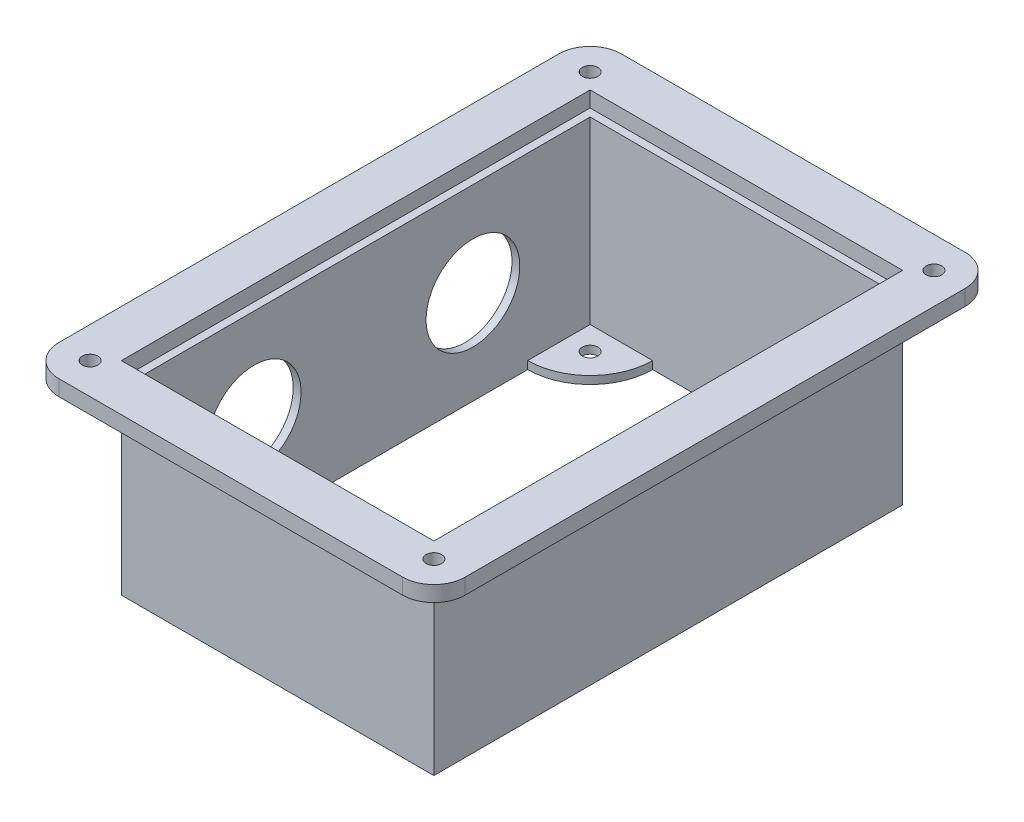
from build123d import *

# Parameters (mm, degrees)
SIDE_VIEW_LARGE_RECT_W       = 120
SIDE_VIEW_LARGE_RECT_H       = 48
SALIENTE_EXTRUIR1_DEPTH      = 80
SALIENTE_EXTRUIR2_DEPTH      = 52
SALIENTE_EXTRUIR2_DEPTH_BACK = 52
CROQUIS4_W                   = 144
CROQUIS4_H                   = 4
CROQUIS6_W                   = 80
CROQUIS6_H                   = 120
CORTAR_EXTRUIR2_DEPTH        = 4
CROQUIS7_W                   = 76
CROQUIS7_H                   = 116
CORTAR_EXTRUIR3_DEPTH        = 168.904734895
CROQUIS8_W                   = 16
CROQUIS8_H                   = 16
SALIENTE_EXTRUIR3_DEPTH      = 2
MATRIZL1_COUNT               = 2
MATRIZL1_PITCH               = 60
MATRIZL1_COUNT_DIR2          = 2
MATRIZL1_PITCH_DIR2          = 100
REDONDEO1_R                  = 16
REDONDEO2_R                  = 16
REDONDEO3_R                  = 16
REDONDEO4_R                  = 16
REDONDEO5_R                  = 8
CROQUIS10_R                  = 2
CORTAR_EXTRUIR4_DEPTH        = 170.091691103
MATRIZL2_COUNT               = 2
MATRIZL2_PITCH               = 88
MATRIZL2_COUNT_DIR2          = 2
MATRIZL2_PITCH_DIR2          = 128
CROQUIS11_R                  = 2
CORTAR_EXTRUIR5_DEPTH        = 170.091691103
MATRIZL4_COUNT               = 2
MATRIZL4_PITCH               = 64
MATRIZL4_COUNT_DIR2          = 2
MATRIZL4_PITCH_DIR2          = 104
CROQUIS12_R                  = 12
CORTAR_EXTRUIR6_DEPTH        = 2


with BuildPart() as part:
    # Side-view-large-rect → Saliente-Extruir1 (new body)
    with BuildSketch(Plane(origin=(0, 0, 0), x_dir=(0, 0, -1), z_dir=(1, 0, 0))):
        with Locations((-60, 24)):
            Rectangle(SIDE_VIEW_LARGE_RECT_W, SIDE_VIEW_LARGE_RECT_H)
    extrude(amount=SALIENTE_EXTRUIR1_DEPTH)

    # Croquis4 → Saliente-Extruir2 (add, two sides: drawn at the far end of the back side and taken through both)
    with BuildSketch(Plane.ZY.offset(-40).offset(-SALIENTE_EXTRUIR2_DEPTH_BACK)):
        with Locations((60, 50)):
            Rectangle(CROQUIS4_W, CROQUIS4_H)
    extrude(amount=SALIENTE_EXTRUIR2_DEPTH + SALIENTE_EXTRUIR2_DEPTH_BACK)

    # Croquis6 → Cortar-Extruir2 (cut)
    with BuildSketch(Plane(origin=(0, 52, 0), x_dir=(1, 0, 0), z_dir=(0, 1, 0))):
        with Locations((40, -60)):
            Rectangle(CROQUIS6_W, CROQUIS6_H)
    extrude(amount=-CORTAR_EXTRUIR2_DEPTH, mode=Mode.SUBTRACT)


with BuildPart() as cortar_extruir2_piece_1:
    # of the separate pieces the step leaves, piece 1, a body of its own (cortar_extruir2_pieces)
    add(part.part.solids().sort_by_distance((0, 0, 120))[0])

    # Croquis7 → Cortar-Extruir3 (cut, through all)
    with BuildSketch(Plane(origin=(0, 48, 0), x_dir=(1, 0, 0), z_dir=(0, 1, 0))):
        with Locations((40, -60)):
            Rectangle(CROQUIS7_W, CROQUIS7_H)
    extrude(amount=-CORTAR_EXTRUIR3_DEPTH, mode=Mode.SUBTRACT)

    # Croquis8 → Saliente-Extruir3 (add)
    with BuildSketch(Plane(origin=(0, 0, 0), x_dir=(-1, 0, 0), z_dir=(0, -1, 0))):
        with Locations((-70, -10)):
            Rectangle(CROQUIS8_W, CROQUIS8_H)
    saliente_extruir3 = extrude(amount=-SALIENTE_EXTRUIR3_DEPTH)

    # MatrizL1: Saliente-Extruir3 2 × 2
    with Locations(*[(-i * MATRIZL1_PITCH, 0, j * MATRIZL1_PITCH_DIR2) for i in range(MATRIZL1_COUNT) for j in range(MATRIZL1_COUNT_DIR2) if (i, j) != (0, 0)]):
        add(saliente_extruir3)

    # Redondeo1
    redondeo1_edges = [cortar_extruir2_piece_1.edges().sort_by_distance(p)[0] for p in [
        (62, 1, 18),
    ]]
    fillet(redondeo1_edges, radius=REDONDEO1_R - 0.0001)  # a hair under: the kernel refuses the full size

    # Redondeo2
    redondeo2_edges = [cortar_extruir2_piece_1.edges().sort_by_distance(p)[0] for p in [
        (18, 1, 18),
    ]]
    fillet(redondeo2_edges, radius=REDONDEO2_R - 0.0001)  # a hair under: the kernel refuses the full size

    # Redondeo3
    redondeo3_edges = [cortar_extruir2_piece_1.edges().sort_by_distance(p)[0] for p in [
        (18, 1, 102),
    ]]
    fillet(redondeo3_edges, radius=REDONDEO3_R - 0.0001)  # a hair under: the kernel refuses the full size

    # Redondeo4
    redondeo4_edges = [cortar_extruir2_piece_1.edges().sort_by_distance(p)[0] for p in [
        (62, 1, 102),
    ]]
    fillet(redondeo4_edges, radius=REDONDEO4_R - 0.0001)  # a hair under: the kernel refuses the full size

    # Croquis11 → Cortar-Extruir5 (cut, through all)
    with BuildSketch(Plane(origin=(0, 0, 0), x_dir=(-1, 0, 0), z_dir=(0, -1, 0))):
        with Locations(Location((-72, -8, 0), (0, 0, 90))):
            Circle(CROQUIS11_R)
    cortar_extruir5 = extrude(amount=-CORTAR_EXTRUIR5_DEPTH, mode=Mode.SUBTRACT)

    # MatrizL4: Cortar-Extruir5 2 × 2
    with Locations(*[(-i * MATRIZL4_PITCH, 0, j * MATRIZL4_PITCH_DIR2) for i in range(MATRIZL4_COUNT) for j in range(MATRIZL4_COUNT_DIR2) if (i, j) != (0, 0)]):
        add(cortar_extruir5, mode=Mode.SUBTRACT)

    # Croquis12 → Cortar-Extruir6 (cut)
    with BuildSketch(Plane.ZY):
        with Locations((32, 24)):
            Circle(CROQUIS12_R)
        with Locations((88, 24)):
            Circle(CROQUIS12_R)
    extrude(amount=-CORTAR_EXTRUIR6_DEPTH, mode=Mode.SUBTRACT)


with BuildPart() as cortar_extruir2_piece_2:
    # of the separate pieces the step leaves, piece 2, a body of its own (cortar_extruir2_pieces)
    add(part.part.solids().sort_by_distance((-12, 48, -12))[0])

    # Redondeo5
    redondeo5_edges = [cortar_extruir2_piece_2.edges().sort_by_distance(p)[0] for p in [
        (92, 50, -12),
        (92, 50, 132),
        (-12, 50, -12),
        (-12, 50, 132),
    ]]
    fillet(redondeo5_edges, radius=REDONDEO5_R)

    # Croquis10 → Cortar-Extruir4 (cut, through all)
    with BuildSketch(Plane(origin=(0, 52, 0), x_dir=(1, 0, 0), z_dir=(0, 1, 0))):
        with Locations(Location((-4, 4, 0), (0, 0, 270))):
            Circle(CROQUIS10_R)
    cortar_extruir4 = extrude(amount=-CORTAR_EXTRUIR4_DEPTH, mode=Mode.SUBTRACT)

    # MatrizL2: Cortar-Extruir4 2 × 2
    with Locations(*[(i * MATRIZL2_PITCH, 0, j * MATRIZL2_PITCH_DIR2) for i in range(MATRIZL2_COUNT) for j in range(MATRIZL2_COUNT_DIR2) if (i, j) != (0, 0)]):
        add(cortar_extruir4, mode=Mode.SUBTRACT)


solid = Compound([cortar_extruir2_piece_1.part, cortar_extruir2_piece_2.part])
